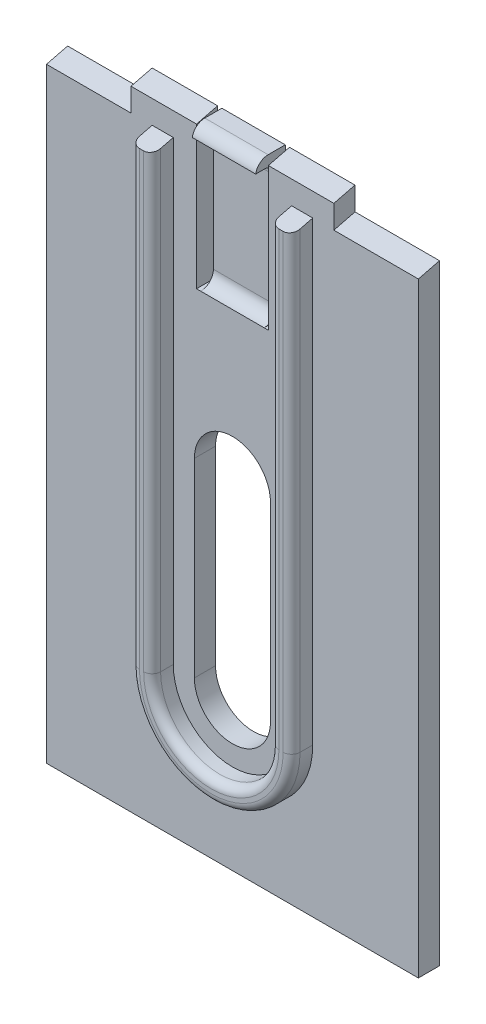
from build123d import *

# Parameters (mm, degrees)
BOSS_EXTRUDE1_DEPTH = 5
CUT_EXTRUDE1_DEPTH  = 20
CUT_EXTRUDE2_DEPTH  = 20
CUT_EXTRUDE3_DEPTH  = 15.5
CUT_EXTRUDE4_DEPTH  = 15.5
SKETCH6_W           = 15
SKETCH6_H           = 32.5
CUT_EXTRUDE5_DEPTH  = 3
FILLET1_R           = 3
SKETCH7_W           = 15
SKETCH7_H           = 2.5
BOSS_EXTRUDE2_DEPTH = 2
FILLET2_R           = 3
FILLET3_R           = 3
CUT_EXTRUDE6_DEPTH  = 5
BOSS_EXTRUDE3_DEPTH = 5
CUT_EXTRUDE7_DEPTH  = 5
CUT_EXTRUDE8_DEPTH  = 5
FILLET4_R           = 2
FILLET5_R           = 2


# Some blends are built 0.0001 mm under size
with BuildPart() as part:
    # Sketch1 → Boss-Extrude1 (new body)
    with BuildSketch(Plane.XY):
        Polygon((0, 0), (0, 144.5), (20, 144.5), (20, 150), (35.5, 150), (35.5, 115), (36.5, 115), (36.5, 150), (51.5, 150), (51.5, 115), (52.5, 115), (52.5, 150), (68, 150), (68, 144.5), (88, 144.5), (88, 0), align=None)
    extrude(amount=BOSS_EXTRUDE1_DEPTH)

    # Sketch2 → Cut-Extrude1 (cut)
    with BuildSketch(Plane(origin=(88, 0, 0), x_dir=(0, 0, -1), z_dir=(1, 0, 0))):
        Polygon((-5, 144.5), (0, 144.5), (-5, 143.253359986), align=None)
    extrude(amount=-CUT_EXTRUDE1_DEPTH, mode=Mode.SUBTRACT)

    # Sketch3 → Cut-Extrude2 (cut)
    with BuildSketch(Plane.ZY):
        Polygon((5, 144.5), (0, 144.5), (5, 143.253359986), align=None)
    extrude(amount=-CUT_EXTRUDE2_DEPTH, mode=Mode.SUBTRACT)

    # Sketch4 → Cut-Extrude3 (cut)
    with BuildSketch(Plane(origin=(68, 0, 0), x_dir=(0, 0, -1), z_dir=(1, 0, 0))):
        Polygon((0, 150), (-5, 148.753359986), (-5, 150), align=None)
    extrude(amount=-CUT_EXTRUDE3_DEPTH, mode=Mode.SUBTRACT)

    # Sketch5 → Cut-Extrude4 (cut)
    with BuildSketch(Plane.ZY.offset(-20)):
        Polygon((0, 150), (5, 150), (5, 148.753359986), align=None)
    extrude(amount=-CUT_EXTRUDE4_DEPTH, mode=Mode.SUBTRACT)

    # Sketch6 → Cut-Extrude5 (cut)
    with BuildSketch(Plane.XY.offset(5)):
        with Locations((44, 131.25)):
            Rectangle(SKETCH6_W, SKETCH6_H)
    extrude(amount=-CUT_EXTRUDE5_DEPTH, mode=Mode.SUBTRACT)

    # Fillet1
    fillet1_edges = [part.edges().sort_by_distance(p)[0] for p in [
        (44, 115, 2),
    ]]
    fillet(fillet1_edges, radius=FILLET1_R - 0.0001)  # a hair under: the kernel refuses the full size

    # Sketch7 → Boss-Extrude2 (add)
    with BuildSketch(Plane.XY.offset(5)):
        with Locations((44, 148.75)):
            Rectangle(SKETCH7_W, SKETCH7_H)
    extrude(amount=BOSS_EXTRUDE2_DEPTH)

    # Fillet2
    fillet2_edges = [part.edges().sort_by_distance(p)[0] for p in [
        (44, 147.5, 2),
    ]]
    fillet(fillet2_edges, radius=FILLET2_R)

    # Fillet3
    # the kernel refuses this fillet: 3 mm, written as the material it takes off along each edge
    with BuildSketch(Plane(origin=(58.895099729, 150, 7), x_dir=(0, -1, 0), z_dir=(-1, 0, 0))) as fillet3_piece_1:
        with BuildLine():
            CenterArc((3, -2.958039892), FILLET3_R, 99.594068227, 80.405931773)
            Line((0, -2.958039892), (-0.06, -2.958039892))
            Line((-0.06, -2.958039892), (-0.06, 0))
            Line((-0.06, 0), (0, 0.06))
            ThreePointArc((0, 0.06), (1.25, 0.06), (2.49, 0.059160798))
            Line((2.49, 0.059160798), (2.5, 0))
        make_face()
    extrude(amount=29.790199458, mode=Mode.SUBTRACT)

    # Sketch8 → Cut-Extrude6 (cut)
    with BuildSketch(Plane.XY.offset(5)):
        with BuildLine():
            Line((35, 80), (35, 35))
            ThreePointArc((35, 35), (44, 26), (53, 35))
            Line((53, 35), (53, 80))
            ThreePointArc((53, 80), (44, 89), (35, 80))
        make_face()
    extrude(amount=-CUT_EXTRUDE6_DEPTH, mode=Mode.SUBTRACT)

    # Sketch9 → Boss-Extrude3 (add)
    with BuildSketch(Plane.XY.offset(5)):
        with BuildLine():
            Line((25, 143.253359986), (25, 35.253359986))
            ThreePointArc((25, 35.253359986), (44, 16.253359986), (63, 35.253359986))
            Line((63, 35.253359986), (63, 143.253359986))
            Line((63, 143.253359986), (58, 143.253359986))
            Line((58, 143.253359986), (58, 35.253359986))
            ThreePointArc((58, 35.253359986), (44, 21.253359986), (30, 35.253359986))
            Line((30, 35.253359986), (30, 143.253359986))
            Line((30, 143.253359986), (25, 143.253359986))
        make_face()
    extrude(amount=BOSS_EXTRUDE3_DEPTH)

    # Sketch10 → Cut-Extrude7 (cut)
    with BuildSketch(Plane.ZY.offset(-25)):
        Polygon((5, 143.253359986), (10, 142.006719972), (10, 143.253359986), align=None)
    extrude(amount=-CUT_EXTRUDE7_DEPTH, mode=Mode.SUBTRACT)

    # Sketch11 → Cut-Extrude8 (cut)
    with BuildSketch(Plane(origin=(63, 0, 0), x_dir=(0, 0, -1), z_dir=(1, 0, 0))):
        Polygon((-5, 143.253359986), (-10, 142.006719972), (-10, 143.253359986), align=None)
    extrude(amount=-CUT_EXTRUDE8_DEPTH, mode=Mode.SUBTRACT)

    # Fillet4
    fillet4_edges = [part.edges().sort_by_distance(p)[0] for p in [
        (44, 16.253359986, 10),
        (63, 88.630039979, 10),
        (25, 88.630039979, 10),
    ]]
    fillet(fillet4_edges, radius=FILLET4_R)

    # Fillet5
    fillet5_edges = [part.edges().sort_by_distance(p)[0] for p in [
        (44, 21.253359986, 10),
        (30, 88.630039979, 10),
        (58, 88.630039979, 10),
    ]]
    fillet(fillet5_edges, radius=FILLET5_R)


solid = part.part
